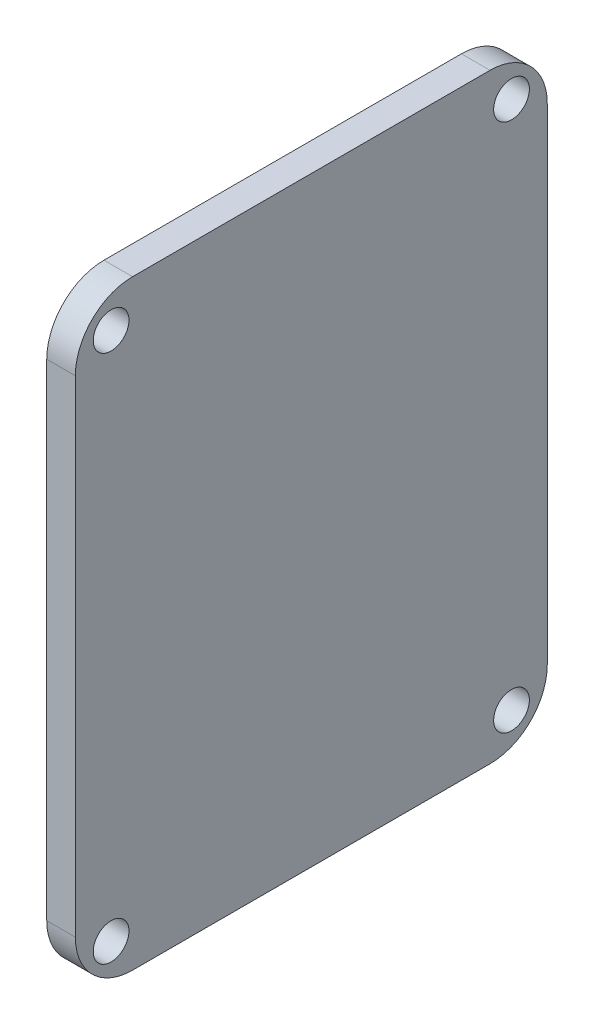
from build123d import *

# Parameters (mm, degrees)
SKETCH2_R           = 1.25
BOSS_EXTRUDE1_DEPTH = 2


with BuildPart() as part:
    # Sketch2 → Boss-Extrude1 (new body)
    with BuildSketch(Plane.YZ):
        with BuildLine():
            Line((-17, -16.5), (17, -16.5))
            ThreePointArc((17, -16.5), (19.828427125, -15.328427125), (21, -12.5))
            Line((21, -12.5), (21, 12.5))
            ThreePointArc((21, 12.5), (19.828427125, 15.328427125), (17, 16.5))
            Line((17, 16.5), (-17, 16.5))
            ThreePointArc((-17, 16.5), (-19.828427125, 15.328427125), (-21, 12.5))
            Line((-21, 12.5), (-21, -12.5))
            ThreePointArc((-21, -12.5), (-19.828427125, -15.328427125), (-17, -16.5))
        make_face()
        with Locations((-18.5, 14)):
            Circle(SKETCH2_R, mode=Mode.SUBTRACT)
        with Locations((-18.5, -14)):
            Circle(SKETCH2_R, mode=Mode.SUBTRACT)
        with Locations((18.5, 14)):
            Circle(SKETCH2_R, mode=Mode.SUBTRACT)
        with Locations((18.5, -14)):
            Circle(SKETCH2_R, mode=Mode.SUBTRACT)
    extrude(amount=BOSS_EXTRUDE1_DEPTH)


solid = part.part
